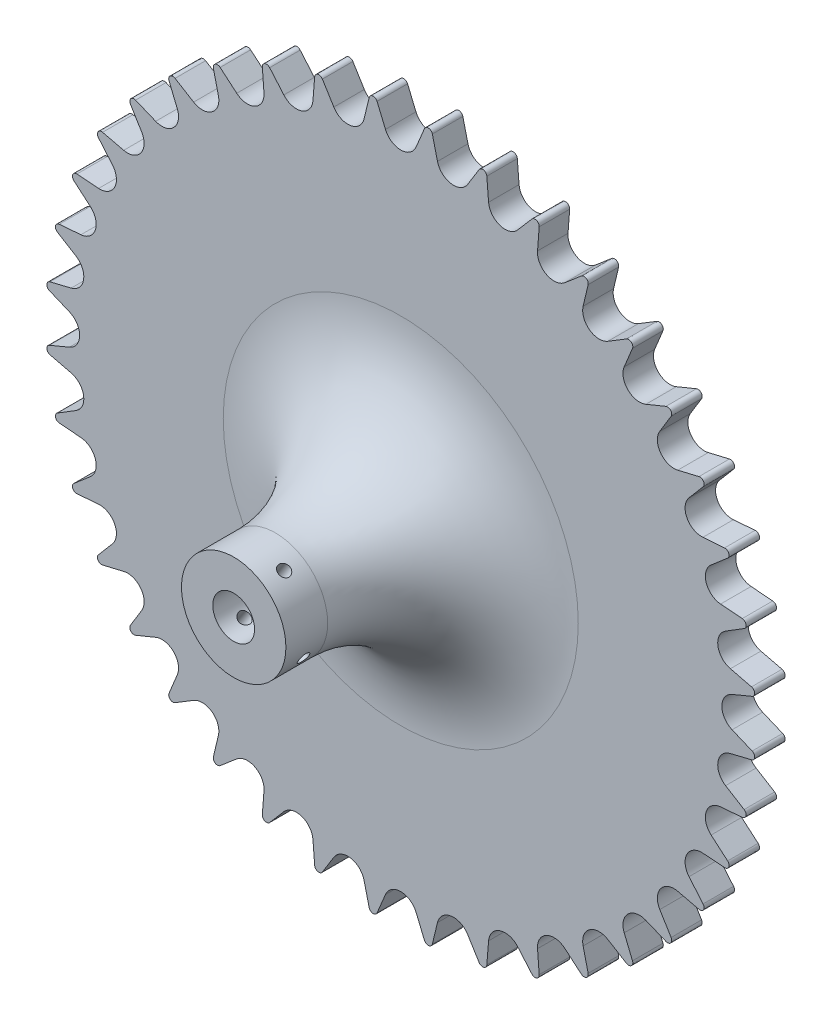
from build123d import *

# Parameters (mm, degrees)
BOSS_EXTRUDE1_DEPTH                 = 7.3
SKETCH2_R                           = 12.5
BOSS_EXTRUDE2_DEPTH                 = 40
FILLET1_R                           = 30
SKETCH3_R                           = 5
CUT_EXTRUDE1_DEPTH                  = 129.838593424
F_1_0MM_DOWEL_HOLE1_D               = 2.8
F_1_0MM_DOWEL_HOLE1_DEPTH           = 33.158795133
F_1_0MM_DOWEL_HOLE1_TIP             = 0.841204867
F_1_0MM_DOWEL_HOLE1_ON_FACE_2_D     = 2.8
F_1_0MM_DOWEL_HOLE1_ON_FACE_2_DEPTH = 33.158795133
F_1_0MM_DOWEL_HOLE1_ON_FACE_2_TIP   = 0.841204867


with BuildPart() as part:
    # Sketch1 → Boss-Extrude1 (new body)
    with BuildSketch(Plane.XY):
        with BuildLine():
            ThreePointArc((3.662609618, 79.321514688), (0, 76.88125), (-3.662609618, 79.321514688))
            Line((-3.662609618, 79.321514688), (-5.667701775, 84.126186191))
            ThreePointArc((-5.667701775, 84.126186191), (-6.669023137, 84.737973367), (-7.562311971, 83.977077135))
            Line((-7.562311971, 83.977077135), (-8.791101901, 78.917893592))
            ThreePointArc((-8.791101901, 78.917893592), (-12.026877215, 75.934714235), (-16.026135532, 77.77197684))
            Line((-16.026135532, 77.77197684), (-18.758157894, 82.203829344))
            ThreePointArc((-18.758157894, 82.203829344), (-19.842855928, 82.651443234), (-20.606116499, 81.760173735))
            Line((-20.606116499, 81.760173735), (-21.028347314, 76.571052042))
            ThreePointArc((-21.028347314, 76.571052042), (-23.757612799, 73.118413793), (-27.995044802, 74.307434811))
            Line((-27.995044802, 74.307434811), (-31.386725911, 78.2573414))
            ThreePointArc((-31.386725911, 78.2573414), (-32.528091751, 78.529760263), (-33.142530051, 77.530063512))
            Line((-33.142530051, 77.530063512), (-32.747805028, 72.338777067))
            ThreePointArc((-32.747805028, 72.338777067), (-34.903357108, 68.501695338), (-39.274623159, 69.013197125))
            Line((-39.274623159, 69.013197125), (-43.242448569, 72.38389799))
            ThreePointArc((-43.242448569, 72.38389799), (-44.412378001, 72.47441397), (-44.862864519, 71.390905818))
            Line((-44.862864519, 71.390905818), (-43.660903098, 66.325281321))
            ThreePointArc((-43.660903098, 66.325281321), (-45.189664928, 62.198237799), (-49.587129948, 62.019625484))
            Line((-49.587129948, 62.019625484), (-54.03339863, 64.728122783))
            ThreePointArc((-54.03339863, 64.728122783), (-55.203084108, 64.634507076), (-55.478526372, 63.49386709))
            Line((-55.478526372, 63.49386709), (-53.498924832, 58.678637028))
            ThreePointArc((-53.498924832, 58.678637028), (-54.363253221, 54.363253221), (-58.678637028, 53.498924832))
            Line((-58.678637028, 53.498924832), (-63.49386709, 55.478526372))
            ThreePointArc((-63.49386709, 55.478526372), (-64.634507076, 55.203084108), (-64.728122783, 54.03339863))
            Line((-64.728122783, 54.03339863), (-62.019625484, 49.587129948))
            ThreePointArc((-62.019625484, 49.587129948), (-62.198237799, 45.189664928), (-66.325281321, 43.660903098))
            Line((-66.325281321, 43.660903098), (-71.390905818, 44.862864519))
            ThreePointArc((-71.390905818, 44.862864519), (-72.47441397, 44.412378001), (-72.38389799, 43.242448569))
            Line((-72.38389799, 43.242448569), (-69.013197125, 39.274623159))
            ThreePointArc((-69.013197125, 39.274623159), (-68.501695338, 34.903357108), (-72.338777067, 32.747805028))
            Line((-72.338777067, 32.747805028), (-77.530063512, 33.142530051))
            ThreePointArc((-77.530063512, 33.142530051), (-78.529760263, 32.528091751), (-78.2573414, 31.386725911))
            Line((-78.2573414, 31.386725911), (-74.307434811, 27.995044802))
            ThreePointArc((-74.307434811, 27.995044802), (-73.118413793, 23.757612799), (-76.571052042, 21.028347314))
            Line((-76.571052042, 21.028347314), (-81.760173735, 20.606116499))
            ThreePointArc((-81.760173735, 20.606116499), (-82.651443234, 19.842855928), (-82.203829344, 18.758157894))
            Line((-82.203829344, 18.758157894), (-77.77197684, 16.026135532))
            ThreePointArc((-77.77197684, 16.026135532), (-75.934714235, 12.026877215), (-78.917893592, 8.791101901))
            Line((-78.917893592, 8.791101901), (-83.977077135, 7.562311971))
            ThreePointArc((-83.977077135, 7.562311971), (-84.737973367, 6.669023137), (-84.126186191, 5.667701775))
            Line((-84.126186191, 5.667701775), (-79.321514688, 3.662609618))
            ThreePointArc((-79.321514688, 3.662609618), (-76.88125, 0), (-79.321514688, -3.662609618))
            Line((-79.321514688, -3.662609618), (-84.126186191, -5.667701775))
            ThreePointArc((-84.126186191, -5.667701775), (-84.737973367, -6.669023137), (-83.977077135, -7.562311971))
            Line((-83.977077135, -7.562311971), (-78.917893592, -8.791101901))
            ThreePointArc((-78.917893592, -8.791101901), (-75.934714235, -12.026877215), (-77.77197684, -16.026135532))
            Line((-77.77197684, -16.026135532), (-82.203829344, -18.758157894))
            ThreePointArc((-82.203829344, -18.758157894), (-82.651443234, -19.842855928), (-81.760173735, -20.606116499))
            Line((-81.760173735, -20.606116499), (-76.571052042, -21.028347314))
            ThreePointArc((-76.571052042, -21.028347314), (-73.118413793, -23.757612799), (-74.307434811, -27.995044802))
            Line((-74.307434811, -27.995044802), (-78.2573414, -31.386725911))
            ThreePointArc((-78.2573414, -31.386725911), (-78.529760263, -32.528091751), (-77.530063512, -33.142530051))
            Line((-77.530063512, -33.142530051), (-72.338777067, -32.747805028))
            ThreePointArc((-72.338777067, -32.747805028), (-68.501695338, -34.903357108), (-69.013197125, -39.274623159))
            Line((-69.013197125, -39.274623159), (-72.38389799, -43.242448569))
            ThreePointArc((-72.38389799, -43.242448569), (-72.47441397, -44.412378001), (-71.390905818, -44.862864519))
            Line((-71.390905818, -44.862864519), (-66.325281321, -43.660903098))
            ThreePointArc((-66.325281321, -43.660903098), (-62.198237799, -45.189664928), (-62.019625484, -49.587129948))
            Line((-62.019625484, -49.587129948), (-64.728122783, -54.03339863))
            ThreePointArc((-64.728122783, -54.03339863), (-64.634507076, -55.203084108), (-63.49386709, -55.478526372))
            Line((-63.49386709, -55.478526372), (-58.678637028, -53.498924832))
            ThreePointArc((-58.678637028, -53.498924832), (-54.363253221, -54.363253221), (-53.498924832, -58.678637028))
            Line((-53.498924832, -58.678637028), (-55.478526372, -63.49386709))
            ThreePointArc((-55.478526372, -63.49386709), (-55.203084108, -64.634507076), (-54.03339863, -64.728122783))
            Line((-54.03339863, -64.728122783), (-49.587129948, -62.019625484))
            ThreePointArc((-49.587129948, -62.019625484), (-45.189664928, -62.198237799), (-43.660903098, -66.325281321))
            Line((-43.660903098, -66.325281321), (-44.862864519, -71.390905818))
            ThreePointArc((-44.862864519, -71.390905818), (-44.412378001, -72.47441397), (-43.242448569, -72.38389799))
            Line((-43.242448569, -72.38389799), (-39.274623159, -69.013197125))
            ThreePointArc((-39.274623159, -69.013197125), (-34.903357108, -68.501695338), (-32.747805028, -72.338777067))
            Line((-32.747805028, -72.338777067), (-33.142530051, -77.530063512))
            ThreePointArc((-33.142530051, -77.530063512), (-32.528091751, -78.529760263), (-31.386725911, -78.2573414))
            Line((-31.386725911, -78.2573414), (-27.995044802, -74.307434811))
            ThreePointArc((-27.995044802, -74.307434811), (-23.757612799, -73.118413793), (-21.028347314, -76.571052042))
            Line((-21.028347314, -76.571052042), (-20.606116499, -81.760173735))
            ThreePointArc((-20.606116499, -81.760173735), (-19.842855928, -82.651443234), (-18.758157894, -82.203829344))
            Line((-18.758157894, -82.203829344), (-16.026135532, -77.77197684))
            ThreePointArc((-16.026135532, -77.77197684), (-12.026877215, -75.934714235), (-8.791101901, -78.917893592))
            Line((-8.791101901, -78.917893592), (-7.562311971, -83.977077135))
            ThreePointArc((-7.562311971, -83.977077135), (-6.669023137, -84.737973367), (-5.667701775, -84.126186191))
            Line((-5.667701775, -84.126186191), (-3.662609618, -79.321514688))
            ThreePointArc((-3.662609618, -79.321514688), (0, -76.88125), (3.662609618, -79.321514688))
            Line((3.662609618, -79.321514688), (5.667701775, -84.126186191))
            ThreePointArc((5.667701775, -84.126186191), (6.669023137, -84.737973367), (7.562311971, -83.977077135))
            Line((7.562311971, -83.977077135), (8.791101901, -78.917893592))
            ThreePointArc((8.791101901, -78.917893592), (12.026877215, -75.934714235), (16.026135532, -77.77197684))
            Line((16.026135532, -77.77197684), (18.758157894, -82.203829344))
            ThreePointArc((18.758157894, -82.203829344), (19.842855928, -82.651443234), (20.606116499, -81.760173735))
            Line((20.606116499, -81.760173735), (21.028347314, -76.571052042))
            ThreePointArc((21.028347314, -76.571052042), (23.757612799, -73.118413793), (27.995044802, -74.307434811))
            Line((27.995044802, -74.307434811), (31.386725911, -78.2573414))
            ThreePointArc((31.386725911, -78.2573414), (32.528091751, -78.529760263), (33.142530051, -77.530063512))
            Line((33.142530051, -77.530063512), (32.747805028, -72.338777067))
            ThreePointArc((32.747805028, -72.338777067), (34.903357108, -68.501695338), (39.274623159, -69.013197125))
            Line((39.274623159, -69.013197125), (43.242448569, -72.38389799))
            ThreePointArc((43.242448569, -72.38389799), (44.412378001, -72.47441397), (44.862864519, -71.390905818))
            Line((44.862864519, -71.390905818), (43.660903098, -66.325281321))
            ThreePointArc((43.660903098, -66.325281321), (45.189664928, -62.198237799), (49.587129948, -62.019625484))
            Line((49.587129948, -62.019625484), (54.03339863, -64.728122783))
            ThreePointArc((54.03339863, -64.728122783), (55.203084108, -64.634507076), (55.478526372, -63.49386709))
            Line((55.478526372, -63.49386709), (53.498924832, -58.678637028))
            ThreePointArc((53.498924832, -58.678637028), (54.363253221, -54.363253221), (58.678637028, -53.498924832))
            Line((58.678637028, -53.498924832), (63.49386709, -55.478526372))
            ThreePointArc((63.49386709, -55.478526372), (64.634507076, -55.203084108), (64.728122783, -54.03339863))
            Line((64.728122783, -54.03339863), (62.019625484, -49.587129948))
            ThreePointArc((62.019625484, -49.587129948), (62.198237799, -45.189664928), (66.325281321, -43.660903098))
            Line((66.325281321, -43.660903098), (71.390905818, -44.862864519))
            ThreePointArc((71.390905818, -44.862864519), (72.47441397, -44.412378001), (72.38389799, -43.242448569))
            Line((72.38389799, -43.242448569), (69.013197125, -39.274623159))
            ThreePointArc((69.013197125, -39.274623159), (68.501695338, -34.903357108), (72.338777067, -32.747805028))
            Line((72.338777067, -32.747805028), (77.530063512, -33.142530051))
            ThreePointArc((77.530063512, -33.142530051), (78.529760263, -32.528091751), (78.2573414, -31.386725911))
            Line((78.2573414, -31.386725911), (74.307434811, -27.995044802))
            ThreePointArc((74.307434811, -27.995044802), (73.118413793, -23.757612799), (76.571052042, -21.028347314))
            Line((76.571052042, -21.028347314), (81.760173735, -20.606116499))
            ThreePointArc((81.760173735, -20.606116499), (82.651443234, -19.842855928), (82.203829344, -18.758157894))
            Line((82.203829344, -18.758157894), (77.77197684, -16.026135532))
            ThreePointArc((77.77197684, -16.026135532), (75.934714235, -12.026877215), (78.917893592, -8.791101901))
            Line((78.917893592, -8.791101901), (83.977077135, -7.562311971))
            ThreePointArc((83.977077135, -7.562311971), (84.737973367, -6.669023137), (84.126186191, -5.667701775))
            Line((84.126186191, -5.667701775), (79.321514688, -3.662609618))
            ThreePointArc((79.321514688, -3.662609618), (76.88125, 0), (79.321514688, 3.662609618))
            Line((79.321514688, 3.662609618), (84.126186191, 5.667701775))
            ThreePointArc((84.126186191, 5.667701775), (84.737973367, 6.669023137), (83.977077135, 7.562311971))
            Line((83.977077135, 7.562311971), (78.917893592, 8.791101901))
            ThreePointArc((78.917893592, 8.791101901), (75.934714235, 12.026877215), (77.77197684, 16.026135532))
            Line((77.77197684, 16.026135532), (82.203829344, 18.758157894))
            ThreePointArc((82.203829344, 18.758157894), (82.651443234, 19.842855928), (81.760173735, 20.606116499))
            Line((81.760173735, 20.606116499), (76.571052042, 21.028347314))
            ThreePointArc((76.571052042, 21.028347314), (73.118413793, 23.757612799), (74.307434811, 27.995044802))
            Line((74.307434811, 27.995044802), (78.2573414, 31.386725911))
            ThreePointArc((78.2573414, 31.386725911), (78.529760263, 32.528091751), (77.530063512, 33.142530051))
            Line((77.530063512, 33.142530051), (72.338777067, 32.747805028))
            ThreePointArc((72.338777067, 32.747805028), (68.501695338, 34.903357108), (69.013197125, 39.274623159))
            Line((69.013197125, 39.274623159), (72.38389799, 43.242448569))
            ThreePointArc((72.38389799, 43.242448569), (72.47441397, 44.412378001), (71.390905818, 44.862864519))
            Line((71.390905818, 44.862864519), (66.325281321, 43.660903098))
            ThreePointArc((66.325281321, 43.660903098), (62.198237799, 45.189664928), (62.019625484, 49.587129948))
            Line((62.019625484, 49.587129948), (64.728122783, 54.03339863))
            ThreePointArc((64.728122783, 54.03339863), (64.634507076, 55.203084108), (63.49386709, 55.478526372))
            Line((63.49386709, 55.478526372), (58.678637028, 53.498924832))
            ThreePointArc((58.678637028, 53.498924832), (54.363253221, 54.363253221), (53.498924832, 58.678637028))
            Line((53.498924832, 58.678637028), (55.478526372, 63.49386709))
            ThreePointArc((55.478526372, 63.49386709), (55.203084108, 64.634507076), (54.03339863, 64.728122783))
            Line((54.03339863, 64.728122783), (49.587129948, 62.019625484))
            ThreePointArc((49.587129948, 62.019625484), (45.189664928, 62.198237799), (43.660903098, 66.325281321))
            Line((43.660903098, 66.325281321), (44.862864519, 71.390905818))
            ThreePointArc((44.862864519, 71.390905818), (44.412378001, 72.47441397), (43.242448569, 72.38389799))
            Line((43.242448569, 72.38389799), (39.274623159, 69.013197125))
            ThreePointArc((39.274623159, 69.013197125), (34.903357108, 68.501695338), (32.747805028, 72.338777067))
            Line((32.747805028, 72.338777067), (33.142530051, 77.530063512))
            ThreePointArc((33.142530051, 77.530063512), (32.528091751, 78.529760263), (31.386725911, 78.2573414))
            Line((31.386725911, 78.2573414), (27.995044802, 74.307434811))
            ThreePointArc((27.995044802, 74.307434811), (23.757612799, 73.118413793), (21.028347314, 76.571052042))
            Line((21.028347314, 76.571052042), (20.606116499, 81.760173735))
            ThreePointArc((20.606116499, 81.760173735), (19.842855928, 82.651443234), (18.758157894, 82.203829344))
            Line((18.758157894, 82.203829344), (16.026135532, 77.77197684))
            ThreePointArc((16.026135532, 77.77197684), (12.026877215, 75.934714235), (8.791101901, 78.917893592))
            Line((8.791101901, 78.917893592), (7.562311971, 83.977077135))
            ThreePointArc((7.562311971, 83.977077135), (6.669023137, 84.737973367), (5.667701775, 84.126186191))
            Line((5.667701775, 84.126186191), (3.662609618, 79.321514688))
        make_face()
    extrude(amount=BOSS_EXTRUDE1_DEPTH)

    # Sketch2 → Boss-Extrude2 (add)
    with BuildSketch(Plane.XY.offset(7.3)):
        Circle(SKETCH2_R)
    extrude(amount=BOSS_EXTRUDE2_DEPTH)

    # Fillet1
    fillet1_edges = [part.edges().sort_by_distance(p)[0] for p in [
        (-12.5, 0, 7.3),
    ]]
    fillet(fillet1_edges, radius=FILLET1_R)

    # Sketch3 → Cut-Extrude1 (cut, through all)
    with BuildSketch(Plane.XY.offset(47.3)):
        Circle(SKETCH3_R)
    extrude(amount=-CUT_EXTRUDE1_DEPTH, mode=Mode.SUBTRACT)

    # Ø1.0mm Dowel Hole1
    with Locations(Plane(origin=(-6.81763654, -10.477109907, 42.020116055), x_dir=(-0.838168792578, 0.545410923202, 0), z_dir=(-0.545410923202, -0.838168792578, 0))):
        with Locations((0, 0)):
            Hole(F_1_0MM_DOWEL_HOLE1_D / 2, depth=F_1_0MM_DOWEL_HOLE1_DEPTH)
            with Locations((0, 0, -(F_1_0MM_DOWEL_HOLE1_DEPTH + F_1_0MM_DOWEL_HOLE1_TIP / 2))):  # 118° drill point
                Cone(0, F_1_0MM_DOWEL_HOLE1_D / 2, F_1_0MM_DOWEL_HOLE1_TIP, mode=Mode.SUBTRACT)

    # Ø1.0mm Dowel Hole1 on face 2
    with Locations(Plane(origin=(-11.068439798, 5.808583342, 41.658255729), x_dir=(-0.464687003812, -0.885475007264, 0), z_dir=(-0.885475007264, 0.464687003812, 0))):
        with Locations((0, 0)):
            Hole(F_1_0MM_DOWEL_HOLE1_ON_FACE_2_D / 2, depth=F_1_0MM_DOWEL_HOLE1_ON_FACE_2_DEPTH)
            with Locations((0, 0, -(F_1_0MM_DOWEL_HOLE1_ON_FACE_2_DEPTH + F_1_0MM_DOWEL_HOLE1_ON_FACE_2_TIP / 2))):  # 118° drill point
                Cone(0, F_1_0MM_DOWEL_HOLE1_ON_FACE_2_D / 2, F_1_0MM_DOWEL_HOLE1_ON_FACE_2_TIP, mode=Mode.SUBTRACT)


solid = part.part
